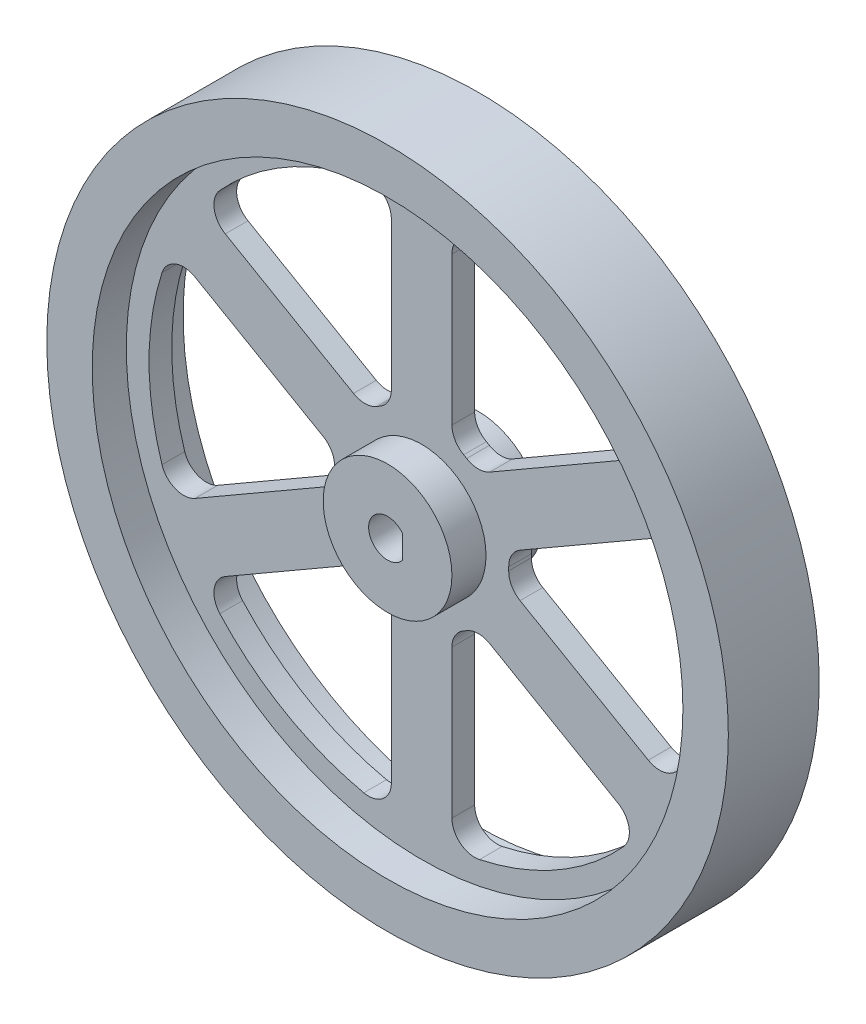
from build123d import *

# Parameters (mm, degrees)
SKETCH1_R             = 45
SKETCH1_R_2           = 39
BOSS_EXTRUDE1_DEPTH   = 6
SKETCH1_R_3           = 8.5
BOSS_EXTRUDE1_2_DEPTH = 6
SKETCH4_R             = 39
SKETCH4_R_2           = 36
SKETCH4_R_3           = 11.5
SKETCH4_R_4           = 8.5
BOSS_EXTRUDE3_DEPTH   = 1.5
BOSS_EXTRUDE2_START   = -1.5
BOSS_EXTRUDE2_DEPTH   = 3
CIRPATTERN6_COUNT     = 6
FILLET1_R             = 3


# Read off the part's stored shape, not the designer's step: Boss-Extrude2
with BuildPart() as part:
    # Sketch1 → Boss-Extrude1 (new, symmetric)
    with BuildSketch(Plane.XY):
        Circle(SKETCH1_R)
        Circle(SKETCH1_R_2, mode=Mode.SUBTRACT)
    extrude(amount=BOSS_EXTRUDE1_DEPTH, both=True)



with BuildPart() as body_2:
    # Sketch1 → Boss-Extrude1 2 (new, symmetric)
    with BuildSketch(Plane.XY):
        Circle(SKETCH1_R_3)
        with BuildLine():
            Line((2, 1.5), (2, -1.5))
            ThreePointArc((2, -1.5), (-2.5, 0), (2, 1.5))
        make_face(mode=Mode.SUBTRACT)
    extrude(amount=BOSS_EXTRUDE1_2_DEPTH, both=True)


with BuildPart() as part_1:
    add(part.part)

    add(body_2.part)  # Boss-Extrude3 merges body 2
    # Sketch4 → Boss-Extrude3 (add, symmetric)
    # profile 1 of 2: a face of its own
    with BuildSketch(Plane.XY):
        Circle(SKETCH4_R)
        Circle(SKETCH4_R_2, mode=Mode.SUBTRACT)
    # profile 2 of 2: a face of its own
    with BuildSketch(Plane.XY):
        Circle(SKETCH4_R_3)
        Circle(SKETCH4_R_4, mode=Mode.SUBTRACT)
    extrude(amount=BOSS_EXTRUDE3_DEPTH, both=True)


with BuildPart() as body_2_2:
    # Boss-Extrude2 outline → Boss-Extrude2 (new body)
    with BuildSketch(Plane.XY.offset(BOSS_EXTRUDE2_START)):
        with BuildLine():
            Line((-4, 35.77708764), (-4, 10.781929326))
            ThreePointArc((-4, 10.781929326), (0, 11.5), (4, 10.781929326))
            Line((4, 10.781929326), (4, 35.77708764))
            ThreePointArc((4, 35.77708764), (0, 36), (-4, 35.77708764))
        make_face()
    extrude(amount=BOSS_EXTRUDE2_DEPTH)


with BuildPart() as cirpattern6_1:
    # CirPattern6: pattern copy
    add(body_2_2.part.rotate(Axis((0, 0, 0), (0, 0, 1)), 1 * 360 / CIRPATTERN6_COUNT))


with BuildPart() as cirpattern6_2:
    # CirPattern6: pattern copy
    add(body_2_2.part.rotate(Axis((0, 0, 0), (0, 0, 1)), 2 * 360 / CIRPATTERN6_COUNT))


with BuildPart() as cirpattern6_3:
    # CirPattern6: pattern copy
    add(body_2_2.part.rotate(Axis((0, 0, 0), (0, 0, 1)), 3 * 360 / CIRPATTERN6_COUNT))


with BuildPart() as cirpattern6_4:
    # CirPattern6: pattern copy
    add(body_2_2.part.rotate(Axis((0, 0, 0), (0, 0, 1)), 4 * 360 / CIRPATTERN6_COUNT))


with BuildPart() as cirpattern6_5:
    # CirPattern6: pattern copy
    add(body_2_2.part.rotate(Axis((0, 0, 0), (0, 0, 1)), 5 * 360 / CIRPATTERN6_COUNT))


with BuildPart() as part_2:
    add(part_1.part)

    # Combine1: union body 2 2, CirPattern6_5, CirPattern6_4, CirPattern6_3, CirPattern6_2, CirPattern6_1
    add(body_2_2.part)
    add(cirpattern6_5.part)
    add(cirpattern6_4.part)
    add(cirpattern6_3.part)
    add(cirpattern6_2.part)
    add(cirpattern6_1.part)

    # Fillet1
    fillet1_edges = [part_2.edges().sort_by_distance(p)[0] for p in [
        (-4, 10.781929326, 0),
        (-11.337424698, 1.926863048, 0),
        (-7.337424698, -8.855066278, 0),
        (4, -10.781929326, 0),
        (11.337424698, -1.926863048, 0),
        (7.337424698, 8.855066278, 0),
        (-4, 35.77708764, 0),
        (4, 10.781929326, 0),
        (4, 35.77708764, 0),
        (28.98386677, 21.352645435, 0),
        (11.337424698, 1.926863048, 0),
        (32.98386677, 14.424442205, 0),
        (32.98386677, -14.424442205, 0),
        (7.337424698, -8.855066278, 0),
        (28.98386677, -21.352645435, 0),
        (4, -35.77708764, 0),
        (-4, -10.781929326, 0),
        (-4, -35.77708764, 0),
        (-28.98386677, -21.352645435, 0),
        (-11.337424698, -1.926863048, 0),
        (-32.98386677, -14.424442205, 0),
        (-32.98386677, 14.424442205, 0),
        (-7.337424698, 8.855066278, 0),
        (-28.98386677, 21.352645435, 0),
    ]]
    fillet(fillet1_edges, radius=FILLET1_R)


solid = part_2.part
